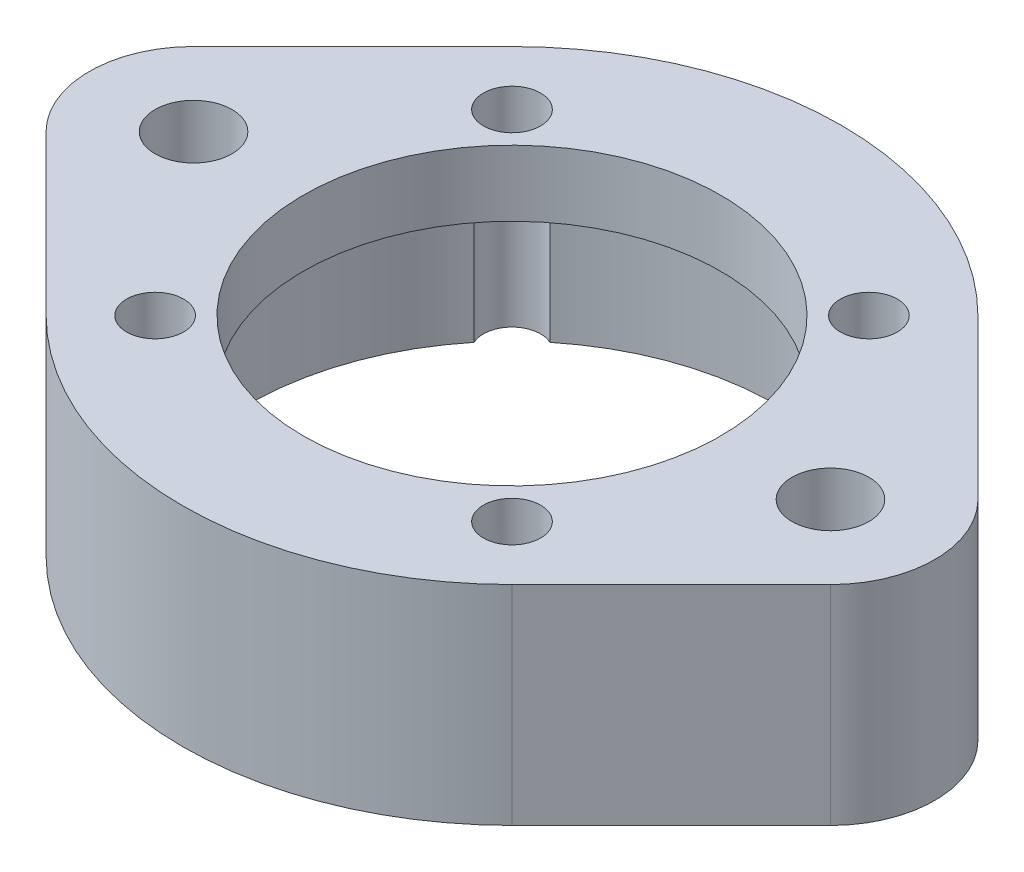
from build123d import *

# Parameters (mm, degrees)
SKETCH1_R           = 12
SKETCH1_R_2         = 1.75
BOSS_EXTRUDE1_DEPTH = 9.5
BOSS_EXTRUDE2_START = -3
SKETCH3_R           = 12
SKETCH3_R_2         = 9.5
BOSS_EXTRUDE2_DEPTH = 3
SKETCH4_R           = 1.3
CUT_EXTRUDE1_DEPTH  = 27.188022071


with BuildPart() as part:
    # Sketch1 → Boss-Extrude1 (new body)
    with BuildSketch(Plane(origin=(0, 0, 0), x_dir=(1, 0, 0), z_dir=(0, 1, 0))):
        with BuildLine():
            Line((-17.857758621, 3.359755504), (-10.603448276, 10.609754222))
            ThreePointArc((-10.603448276, 10.609754222), (0, 15), (10.603448276, 10.609754222))
            Line((10.603448276, 10.609754222), (17.857758621, 3.359755504))
            ThreePointArc((17.857758621, 3.359755504), (19.25, 0), (17.857758621, -3.359755504))
            Line((17.857758621, -3.359755504), (10.603448276, -10.609754222))
            ThreePointArc((10.603448276, -10.609754222), (0, -15), (-10.603448276, -10.609754222))
            Line((-10.603448276, -10.609754222), (-17.857758621, -3.359755504))
            ThreePointArc((-17.857758621, -3.359755504), (-19.25, 0), (-17.857758621, 3.359755504))
        make_face()
        Circle(SKETCH1_R, mode=Mode.SUBTRACT)
        with Locations((-14.5, 0)):
            Circle(SKETCH1_R_2, mode=Mode.SUBTRACT)
        with Locations((14.5, 0)):
            Circle(SKETCH1_R_2, mode=Mode.SUBTRACT)
    extrude(amount=BOSS_EXTRUDE1_DEPTH)

    # Sketch3 → Boss-Extrude2 (add)
    with BuildSketch(Plane(origin=(0, 9.5, 0), x_dir=(1, 0, 0), z_dir=(0, 1, 0)).offset(BOSS_EXTRUDE2_START)):
        Circle(SKETCH3_R)
        Circle(SKETCH3_R_2, mode=Mode.SUBTRACT)
    extrude(amount=BOSS_EXTRUDE2_DEPTH)

    # Sketch4 → Cut-Extrude1 (cut, through all)
    with BuildSketch(Plane(origin=(0, 9.5, 0), x_dir=(1, 0, 0), z_dir=(0, 1, 0))):
        with Locations((8.125, 8.125)):
            Circle(SKETCH4_R)
        with Locations((-8.125, 8.125)):
            Circle(SKETCH4_R)
        with Locations((-8.125, -8.125)):
            Circle(SKETCH4_R)
        with Locations((8.125, -8.125)):
            Circle(SKETCH4_R)
    extrude(amount=-CUT_EXTRUDE1_DEPTH, mode=Mode.SUBTRACT)


solid = part.part
